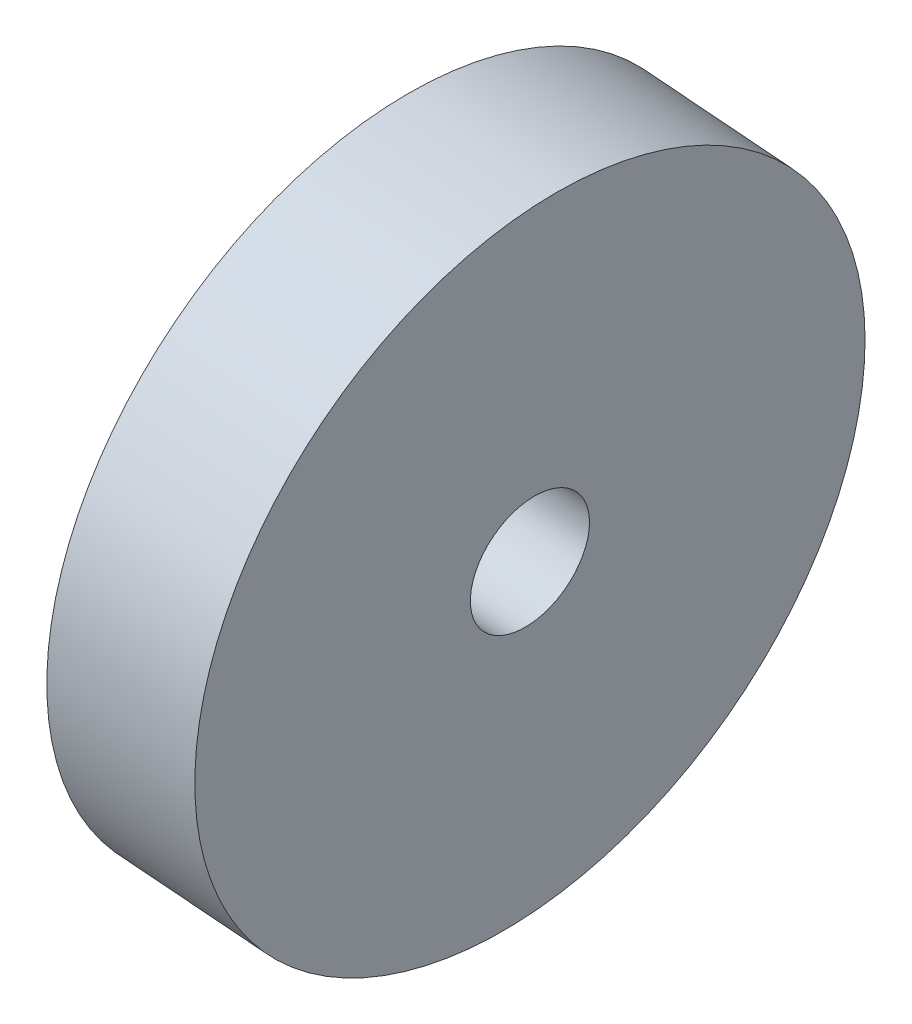
from build123d import *

# Parameters (mm, degrees)
SKETCH1_R           = 14.2875
BOSS_EXTRUDE1_DEPTH = 6.35
SKETCH2_R           = 2.54
CUT_EXTRUDE1_DEPTH  = 5.08


with BuildPart() as part:
    # Sketch1 → Boss-Extrude1 (new body)
    with BuildSketch(Plane(origin=(234.278878836, -18.689027227, 0), x_dir=(0, 0, -1), z_dir=(0.9968332748770866, -0.0795199477981641, 0))):
        with Locations((-43.174261814, 8.550344032)):
            Circle(SKETCH1_R)
    extrude(amount=-BOSS_EXTRUDE1_DEPTH)

    # Sketch2 → Cut-Extrude1 (cut)
    with BuildSketch(Plane(origin=(234.278878836, -18.689027227, 0), x_dir=(0, 0, -1), z_dir=(0.9968332748770866, -0.07951994779816411, 0))):
        with Locations((-43.174261814, 8.550344032)):
            Circle(SKETCH2_R)
    extrude(amount=-CUT_EXTRUDE1_DEPTH, mode=Mode.SUBTRACT)


solid = part.part
